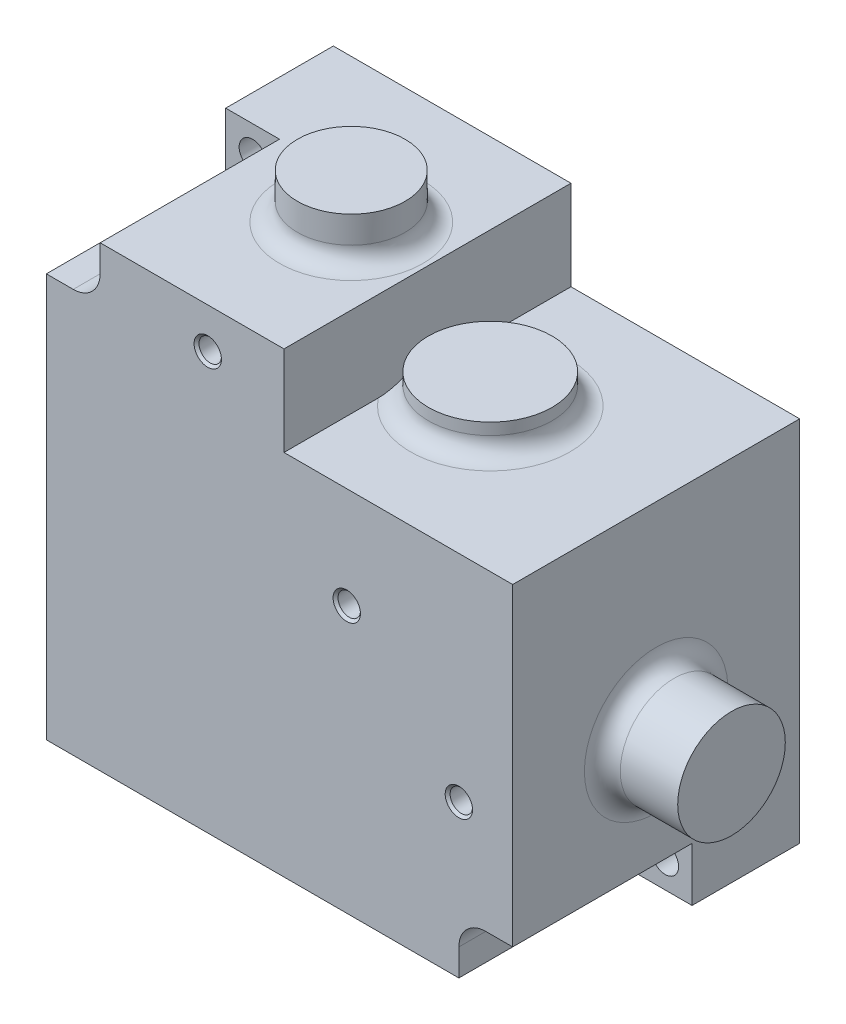
from build123d import *

# Parameters (mm, degrees)
BOSS_EXTRUDE1_DEPTH         = 32
SKETCH2_R                   = 9.5
CUT_EXTRUDE1_DEPTH          = 0.3
SKETCH3_R                   = 4
CUT_EXTRUDE2_DEPTH          = 5
CUT_EXTRUDE3_DEPTH          = 20
CUT_EXTRUDE4_DEPTH          = 76.531450403
CUT_EXTRUDE4_DEPTH_BACK     = 76.531450403
SKETCH5_R                   = 1.5
M3_TAPPED_HOLE1_D           = 2.5
M3_TAPPED_HOLE1_DEPTH       = 7.5
M3_TAPPED_HOLE1_CSINK_D     = 3.05
M3_TAPPED_HOLE1_CSINK_ANGLE = 90
M3_TAPPED_HOLE1_TIP         = 0.751075774
SKETCH9_W                   = 39.8
SKETCH9_H                   = 23.4
BOSS_EXTRUDE2_DEPTH         = 1.1
SKETCH10_R                  = 6
BOSS_EXTRUDE3_DEPTH         = 8.4
SKETCH11_R                  = 6
BOSS_EXTRUDE4_DEPTH         = 5
SKETCH12_R                  = 6.894871922
BOSS_EXTRUDE5_DEPTH         = 3.3
FILLET1_R                   = 2
M3_TAPPED_HOLE2_D           = 2.5
M3_TAPPED_HOLE2_DEPTH       = 7.5
M3_TAPPED_HOLE2_CSINK_D     = 3.05
M3_TAPPED_HOLE2_CSINK_ANGLE = 90
M3_TAPPED_HOLE2_TIP         = 0.751075774


with BuildPart() as part:
    # Sketch1 → Boss-Extrude1 (new body)
    with BuildSketch(Plane.XY):
        Polygon((-25.5, 51), (-25.5, 41), (0, 41), (0, 0), (-52, 0), (-52, 51), align=None)
    extrude(amount=BOSS_EXTRUDE1_DEPTH)

    # Sketch2 → Cut-Extrude1 (cut)
    with BuildSketch(Plane.ZY.offset(52)):
        with Locations((16, 16.75)):
            Circle(SKETCH2_R)
    extrude(amount=-CUT_EXTRUDE1_DEPTH, mode=Mode.SUBTRACT)

    # Sketch3 → Cut-Extrude2 (cut)
    with BuildSketch(Plane.ZY.offset(51.7)):
        with Locations((16, 16.75)):
            Circle(SKETCH3_R)
    extrude(amount=-CUT_EXTRUDE2_DEPTH, mode=Mode.SUBTRACT)

    # Sketch4 → Cut-Extrude3 (cut)
    with BuildSketch(Plane.XY.offset(32)):
        with BuildLine():
            Line((-6, 3), (-6, 0))
            Line((-6, 0), (0, 0))
            Line((0, 0), (0, 6))
            Line((0, 6), (-3, 6))
            ThreePointArc((-3, 6), (-5.121320344, 5.121320344), (-6, 3))
        make_face()
        with BuildLine():
            Line((-52, 45), (-49, 45))
            ThreePointArc((-49, 45), (-46.878679656, 45.878679656), (-46, 48))
            Line((-46, 48), (-46, 51))
            Line((-46, 51), (-52, 51))
            Line((-52, 51), (-52, 45))
        make_face()
    extrude(amount=-CUT_EXTRUDE3_DEPTH, mode=Mode.SUBTRACT)

    # Sketch5 → Cut-Extrude4 (cut, two sides: drawn at the far end of the back side and taken through both)
    with BuildSketch(Plane.XY.offset(12).offset(-CUT_EXTRUDE4_DEPTH_BACK)):
        with Locations((-3, 3)):
            Circle(SKETCH5_R)
        with Locations((-49, 48)):
            Circle(SKETCH5_R)
    extrude(amount=CUT_EXTRUDE4_DEPTH + CUT_EXTRUDE4_DEPTH_BACK, mode=Mode.SUBTRACT)

    # M3 Tapped Hole1
    with Locations(Plane(origin=(0, 0, 0), x_dir=(-1, 0, 0), z_dir=(0, 0, -1))):
        with Locations((7, 31), (7, 11), (47, 31)):
            CounterSinkHole(M3_TAPPED_HOLE1_D / 2, M3_TAPPED_HOLE1_CSINK_D / 2, depth=M3_TAPPED_HOLE1_DEPTH, counter_sink_angle=M3_TAPPED_HOLE1_CSINK_ANGLE)
            with Locations((0, 0, -(M3_TAPPED_HOLE1_DEPTH + M3_TAPPED_HOLE1_TIP / 2))):  # 118° drill point
                Cone(0, M3_TAPPED_HOLE1_D / 2, M3_TAPPED_HOLE1_TIP, mode=Mode.SUBTRACT)

    # Sketch9 → Boss-Extrude2 (add)
    with BuildSketch(Plane.XZ):
        with Locations((-28.3, 15.3)):
            Rectangle(SKETCH9_W, SKETCH9_H)
    extrude(amount=BOSS_EXTRUDE2_DEPTH)

    # Sketch10 → Boss-Extrude3 (add)
    with BuildSketch(Plane(origin=(0, 0, 0), x_dir=(0, 0, -1), z_dir=(1, 0, 0))):
        with Locations(Location((-16, 18.94541958, 0), (0, 0, 180))):
            Circle(SKETCH10_R)
    extrude(amount=BOSS_EXTRUDE3_DEPTH)

    # Sketch11 → Boss-Extrude4 (add)
    with BuildSketch(Plane(origin=(0, 51, 0), x_dir=(1, 0, 0), z_dir=(0, 1, 0))):
        with Locations(Location((-34, -16, 0), (0, 0, 90))):
            Circle(SKETCH11_R)
    extrude(amount=BOSS_EXTRUDE4_DEPTH)

    # Sketch12 → Boss-Extrude5 (add)
    with BuildSketch(Plane(origin=(0, 41, 0), x_dir=(1, 0, 0), z_dir=(0, 1, 0))):
        with Locations(Location((-18.5, -16, 0), (0, 0, 90))):
            Circle(SKETCH12_R)
    extrude(amount=BOSS_EXTRUDE5_DEPTH)

    # Fillet1
    # the kernel refuses this fillet: 2 mm, written as the material it adds along each edge
    with BuildSketch(Plane(origin=(-34, 51, 16), x_dir=(0, 0, -1), z_dir=(1, 0, 0))) as fillet1_piece_1:
        with BuildLine():
            CenterArc((6 + FILLET1_R, FILLET1_R), FILLET1_R, 180, 90)
            Line((6, FILLET1_R), (6, 0))
            Line((6, 0), (6 + FILLET1_R, 0))
        make_face()
    revolve(axis=Axis((-34, 51, 16), (0, 1, 0)))
    with BuildSketch(Plane(origin=(-18.5, 41, 16), x_dir=(0, 0, -1), z_dir=(1, 0, 0))) as fillet1_piece_2:
        with BuildLine():
            CenterArc((6.894871922 + FILLET1_R, FILLET1_R), FILLET1_R, 180, 90)
            Line((6.894871922, FILLET1_R), (6.894871922, 0))
            Line((6.894871922, 0), (6.894871922 + FILLET1_R, 0))
        make_face()
    revolve(axis=Axis((-18.5, 41, 16), (0, 1, 0)))
    with BuildSketch(Plane(origin=(0, 18.94541958, 16), x_dir=(0, 0, 1), z_dir=(0, 1, 0))) as fillet1_piece_3:
        with BuildLine():
            CenterArc((6 + FILLET1_R, FILLET1_R), FILLET1_R, 180, 90)
            Line((6, FILLET1_R), (6, 0))
            Line((6, 0), (6 + FILLET1_R, 0))
        make_face()
    revolve(axis=Axis((0, 18.94541958, 16), (1, 0, 0)))

    # M3 Tapped Hole2
    with Locations(Plane.XY.offset(32)):
        with Locations((-34, 46.5), (-18.5, 29.7), (-6, 17)):
            CounterSinkHole(M3_TAPPED_HOLE2_D / 2, M3_TAPPED_HOLE2_CSINK_D / 2, depth=M3_TAPPED_HOLE2_DEPTH, counter_sink_angle=M3_TAPPED_HOLE2_CSINK_ANGLE)
            with Locations((0, 0, -(M3_TAPPED_HOLE2_DEPTH + M3_TAPPED_HOLE2_TIP / 2))):  # 118° drill point
                Cone(0, M3_TAPPED_HOLE2_D / 2, M3_TAPPED_HOLE2_TIP, mode=Mode.SUBTRACT)


solid = part.part
